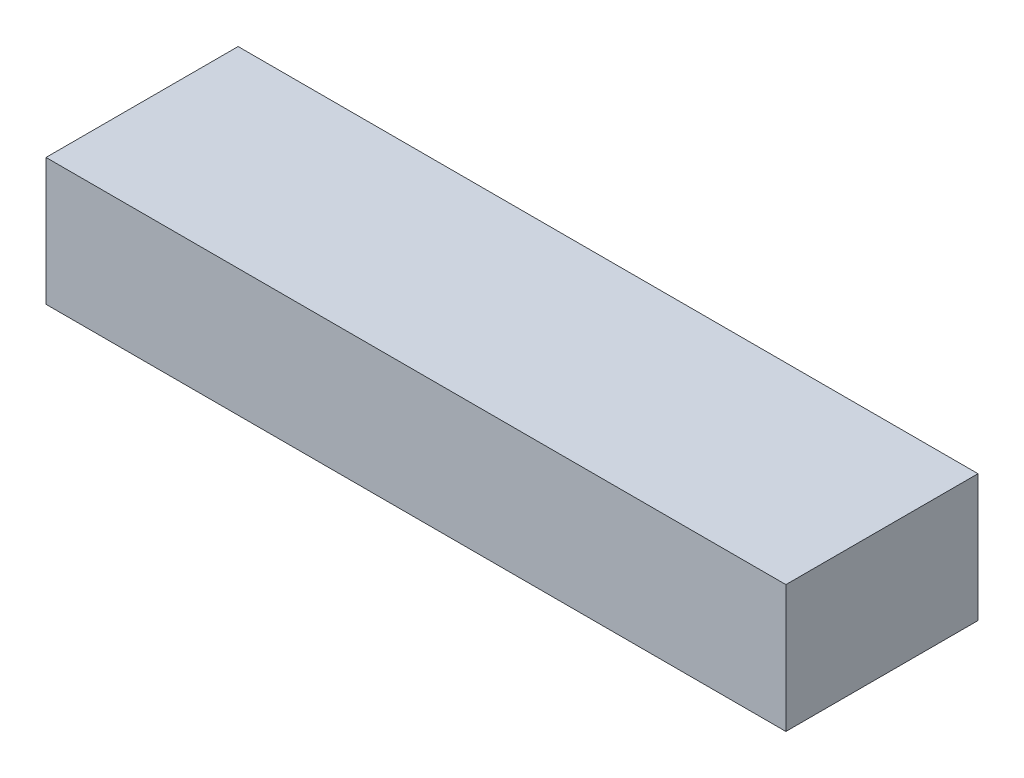
from build123d import *

# Parameters (mm, degrees)
SKETCH1_W           = 1140
SKETCH1_H           = 296
BOSS_EXTRUDE1_DEPTH = 196


with BuildPart() as part:
    # Sketch1 → Boss-Extrude1 (new body)
    with BuildSketch(Plane(origin=(0, 0, 0), x_dir=(1, 0, 0), z_dir=(0, 1, 0))):
        Rectangle(SKETCH1_W, SKETCH1_H)
    extrude(amount=BOSS_EXTRUDE1_DEPTH)


solid = part.part
